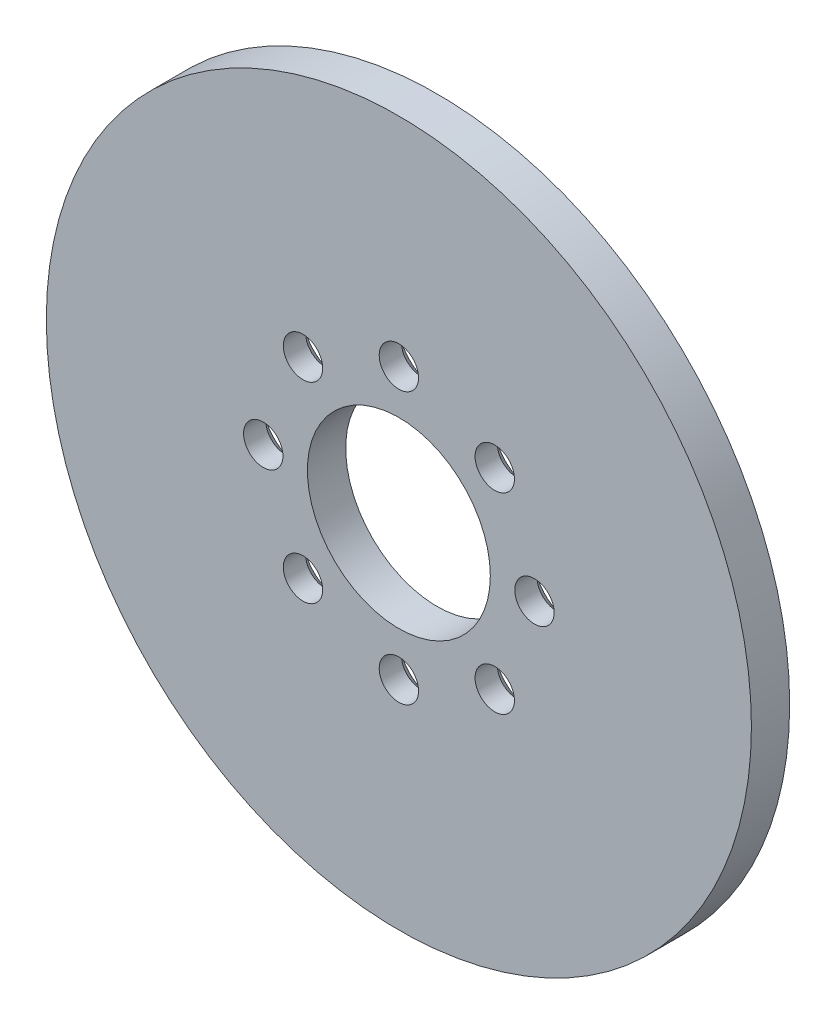
from build123d import *

# Parameters (mm, degrees)
SKETCH1_R                                           = 58.5
SKETCH1_R_2                                         = 3.2639
SKETCH1_R_3                                         = 15.175
BOSS_EXTRUDE1_DEPTH                                 = 6.35
CSK_FOR_1_4_FLAT_HEAD_MACHINE_SCREW_100_D           = 6.5278
CSK_FOR_1_4_FLAT_HEAD_MACHINE_SCREW_100_DEPTH       = 54.11
CSK_FOR_1_4_FLAT_HEAD_MACHINE_SCREW_100_CSINK_D     = 12.8778
CSK_FOR_1_4_FLAT_HEAD_MACHINE_SCREW_100_CSINK_ANGLE = 100
CSK_FOR_1_4_FLAT_HEAD_MACHINE_SCREW_100_TIP         = 1.961148974


with BuildPart() as part:
    # Sketch1 → Boss-Extrude1 (new body)
    with BuildSketch(Plane.XY):
        Circle(SKETCH1_R)
        with Locations((-15.909902577, -15.909902577)):
            Circle(SKETCH1_R_2, mode=Mode.SUBTRACT)
        with Locations((0, -22.5)):
            Circle(SKETCH1_R_2, mode=Mode.SUBTRACT)
        with Locations((15.909902577, -15.909902577)):
            Circle(SKETCH1_R_2, mode=Mode.SUBTRACT)
        with Locations((-22.5, 0)):
            Circle(SKETCH1_R_2, mode=Mode.SUBTRACT)
        with Locations((-15.909902577, 15.909902577)):
            Circle(SKETCH1_R_2, mode=Mode.SUBTRACT)
        Circle(SKETCH1_R_3, mode=Mode.SUBTRACT)
        with Locations((22.5, 0)):
            Circle(SKETCH1_R_2, mode=Mode.SUBTRACT)
        with Locations((0, 22.5)):
            Circle(SKETCH1_R_2, mode=Mode.SUBTRACT)
        with Locations((15.909902577, 15.909902577)):
            Circle(SKETCH1_R_2, mode=Mode.SUBTRACT)
    extrude(amount=BOSS_EXTRUDE1_DEPTH)

    # CSK for 1/4 Flat Head Machine Screw (100)1
    with Locations(Plane(origin=(0, 0, 0), x_dir=(-1, 0, 0), z_dir=(0, 0, -1))):
        with Locations((-15.909902577, 15.909902577), (0, 22.5), (15.909902577, 15.909902577), (22.5, 0), (15.909902577, -15.909902577), (0, -22.5), (-15.909902577, -15.909902577), (-22.5, 0)):
            CounterSinkHole(CSK_FOR_1_4_FLAT_HEAD_MACHINE_SCREW_100_D / 2, CSK_FOR_1_4_FLAT_HEAD_MACHINE_SCREW_100_CSINK_D / 2, depth=CSK_FOR_1_4_FLAT_HEAD_MACHINE_SCREW_100_DEPTH, counter_sink_angle=CSK_FOR_1_4_FLAT_HEAD_MACHINE_SCREW_100_CSINK_ANGLE)
            with Locations((0, 0, -(CSK_FOR_1_4_FLAT_HEAD_MACHINE_SCREW_100_DEPTH + CSK_FOR_1_4_FLAT_HEAD_MACHINE_SCREW_100_TIP / 2))):  # 118° drill point
                Cone(0, CSK_FOR_1_4_FLAT_HEAD_MACHINE_SCREW_100_D / 2, CSK_FOR_1_4_FLAT_HEAD_MACHINE_SCREW_100_TIP, mode=Mode.SUBTRACT)


solid = part.part
